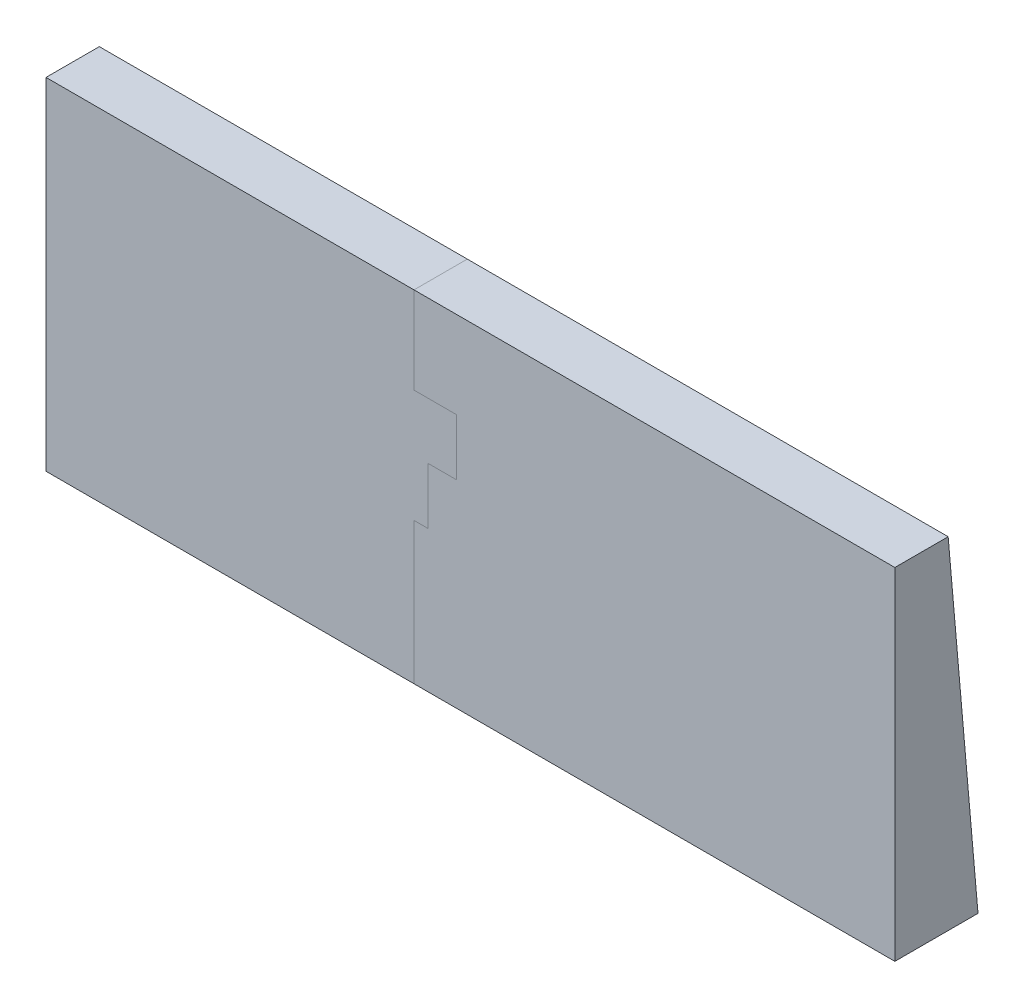
from build123d import *

# Parameters (mm, degrees)
SKETCH1_W              = 286.653251063
SKETCH1_H              = 115.194569729
SKETCH1_W_2            = 269.653251063
SKETCH1_H_2            = 98.194569729
BOSS_EXTRUDE1_DEPTH    = 15
SKETCH2_W              = 286.653251063
SKETCH2_H              = 115.194569729
BOSS_EXTRUDE2_DEPTH    = 3
BOSS_EXTRUDE5_START    = -276.778340417
BOSS_EXTRUDE5_DEPTH    = 286.653251063
BOSS_EXTRUDE5_2_DEPTH  = 8.5
BOSS_EXTRUDE5_START_2  = 1.374910646
BOSS_EXTRUDE5_3_DEPTH  = 8.5
SPLIT1_SURFACE_1_BACK  = 311.207
SPLIT1_SURFACE_1_DEPTH = 622.414
SPLIT1_SURFACE_2_BACK  = 311.207
SPLIT1_SURFACE_2_DEPTH = 622.414


# Read off the part's stored shape, not the designer's step: Boss-Extrude5
with BuildPart() as part:
    # Sketch1 → Boss-Extrude1 (new body)
    with BuildSketch(Plane.XY):
        with Locations((-133.451714886, 47.884990749)):
            Rectangle(SKETCH1_W, SKETCH1_H)
        with Locations((-133.451714886, 47.884990749)):
            Rectangle(SKETCH1_W_2, SKETCH1_H_2, mode=Mode.SUBTRACT)
    extrude(amount=BOSS_EXTRUDE1_DEPTH)

    # Sketch2 → Boss-Extrude2 (add)
    with BuildSketch(Plane.XY.offset(15)):
        with Locations((-133.451714886, 47.884990749)):
            Rectangle(SKETCH2_W, SKETCH2_H)
    extrude(amount=BOSS_EXTRUDE2_DEPTH)

    # Boss-Extrude5 outline → Boss-Extrude5 (add)
    with BuildSketch(Plane.YZ.offset(BOSS_EXTRUDE5_START)):
        Polygon((-9.712294115, 0), (-9.712294115, -10.078218951), (-1.212294115, -9.334565311), (-1.212294115, 0), align=None)
        Polygon((96.982275614, 0), (96.982275614, -0.74365364), (105.482275614, 0), align=None)
    extrude(amount=BOSS_EXTRUDE5_DEPTH)

    # Boss-Extrude5 2 outline → Boss-Extrude5 2 (add)
    with BuildSketch(Plane.YZ.offset(BOSS_EXTRUDE5_START)):
        Polygon((-1.212294115, 0), (-1.212294115, -9.334565311), (96.982275614, -0.74365364), (96.982275614, 0), align=None)
    extrude(amount=BOSS_EXTRUDE5_2_DEPTH)

    # Boss-Extrude5 3 outline → Boss-Extrude5 3 (add)
    with BuildSketch(Plane.YZ.offset(BOSS_EXTRUDE5_START_2)):
        Polygon((-1.212294115, 0), (-1.212294115, -9.334565311), (96.982275614, -0.74365364), (96.982275614, 0), align=None)
    extrude(amount=BOSS_EXTRUDE5_3_DEPTH)


with BuildPart() as body_2:
    # Split1: the piece behind the surface
    add(part.part)
    # Split1 surface: a surface, the sketch's curves swept straight by 622.414 mm
    with BuildLine(Plane.XY.offset(18).offset(-SPLIT1_SURFACE_1_BACK), mode=Mode.PRIVATE) as split1_surface_1_path:
        Line((-152.504909845, 105.482275614), (-152.504909845, 76.162844284))
        Line((-152.504909845, 76.162844284), (-138.215345367, 76.162844284))
        Line((-138.215345367, 76.162844284), (-138.215345367, 57.111891736))
        Line((-138.215345367, 57.111891736), (-147.740821641, 57.111891736))
        Line((-147.740821641, 57.111891736), (-147.740821641, 38.060839184))
        Line((-147.740821641, 38.060839184), (-152.504909845, 38.060839184))
        Line((-152.504909845, 38.060839184), (-152.504909845, -9.712294115))
        Line((-152.504909845, -9.712294115), (-276.778340417, -9.712294115))
        Line((-276.778340417, -9.712294115), (-276.778340417, 105.482275614))
        Line((-276.778340417, 105.482275614), (-152.504909845, 105.482275614))
    split1_surface_1 = Shell.extrude(split1_surface_1_path.wire(), (0 * SPLIT1_SURFACE_1_DEPTH, 0 * SPLIT1_SURFACE_1_DEPTH, 1 * SPLIT1_SURFACE_1_DEPTH))
    split(bisect_by=split1_surface_1, keep=Keep.BOTTOM)


with BuildPart() as part_1:
    add(part.part)

    # Split1: split by a surface, the side it looks to stays
    # Split1 surface: a surface, the sketch's curves swept straight by 622.414 mm
    with BuildLine(Plane.XY.offset(18).offset(-SPLIT1_SURFACE_2_BACK), mode=Mode.PRIVATE) as split1_surface_2_path:
        Line((-152.504909845, 105.482275614), (-152.504909845, 76.162844284))
        Line((-152.504909845, 76.162844284), (-138.215345367, 76.162844284))
        Line((-138.215345367, 76.162844284), (-138.215345367, 57.111891736))
        Line((-138.215345367, 57.111891736), (-147.740821641, 57.111891736))
        Line((-147.740821641, 57.111891736), (-147.740821641, 38.060839184))
        Line((-147.740821641, 38.060839184), (-152.504909845, 38.060839184))
        Line((-152.504909845, 38.060839184), (-152.504909845, -9.712294115))
        Line((-152.504909845, -9.712294115), (-276.778340417, -9.712294115))
        Line((-276.778340417, -9.712294115), (-276.778340417, 105.482275614))
        Line((-276.778340417, 105.482275614), (-152.504909845, 105.482275614))
    split1_surface_2 = Shell.extrude(split1_surface_2_path.wire(), (0 * SPLIT1_SURFACE_2_DEPTH, 0 * SPLIT1_SURFACE_2_DEPTH, 1 * SPLIT1_SURFACE_2_DEPTH))
    split(bisect_by=split1_surface_2, keep=Keep.TOP)


solid = Compound([body_2.part, part_1.part])
